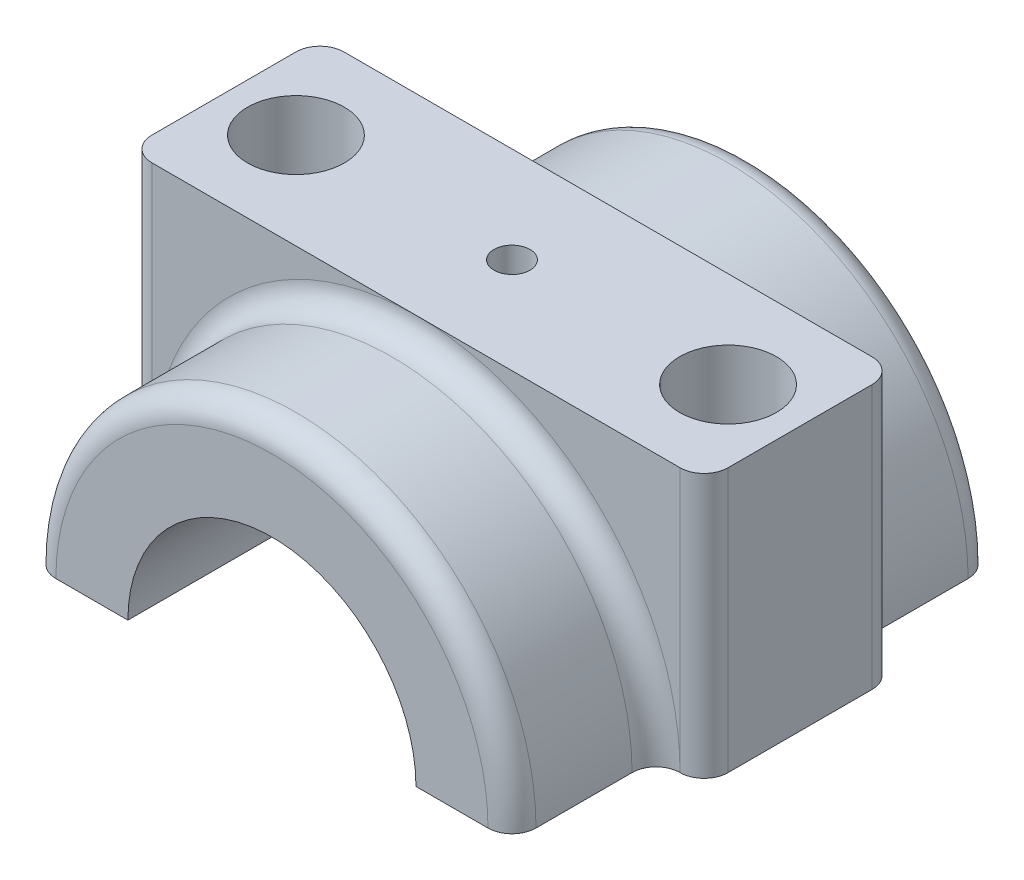
from build123d import *

# Parameters (mm, degrees)
SKETCH_2_W      = 72
SKETCH_2_H      = 24
SKETCH_2_R      = 6.05
SKETCH_2_R_2    = 2.25
EXTRUDE_1_DEPTH = 33
FILLET_1_R      = 3
EXTRUDE_2_DEPTH = 18
EXTRUDE_START   = 18
EXTRUDE_3_DEPTH = 18
FILLET_2_R      = 3


with BuildPart() as part:
    # 草圖2 → 填料-伸長1 (new body)
    with BuildSketch(Plane(origin=(0, 0, 0), x_dir=(1, 0, 0), z_dir=(0, 1, 0))):
        with Locations((36, 12)):
            Rectangle(SKETCH_2_W, SKETCH_2_H)
        with Locations(Location((9, 12, 0), (0, 0, 270))):
            Circle(SKETCH_2_R, mode=Mode.SUBTRACT)
        with Locations(Location((63, 12, 0), (0, 0, 270))):
            Circle(SKETCH_2_R, mode=Mode.SUBTRACT)
        with Locations(Location((36, 12, 0), (0, 0, 270))):
            Circle(SKETCH_2_R_2, mode=Mode.SUBTRACT)
    extrude(amount=EXTRUDE_1_DEPTH)

    # 圓角1
    fillet_1_edges = [part.edges().sort_by_distance(p)[0] for p in [
        (0, 16.5, -24),
        (72, 16.5, -24),
        (72, 16.5, 0),
        (0, 16.5, 0),
    ]]
    fillet(fillet_1_edges, radius=FILLET_1_R)

    # 草圖4 → 填料-伸長2 (add)
    with BuildSketch(Plane.XY):
        with BuildLine():
            ThreePointArc((66, 0), (36, 30), (6, 0))
            Line((6, 0), (18, 0))
            ThreePointArc((18, 0), (36, 18), (54, 0))
            Line((54, 0), (66, 0))
        make_face()
    extrude(amount=EXTRUDE_2_DEPTH)

    # 草圖5 → 填料-伸長3 (add)
    with BuildSketch(Plane(origin=(0, 0, -24), x_dir=(-1, 0, 0), z_dir=(0, 0, -1)).offset(EXTRUDE_START)):
        with BuildLine():
            ThreePointArc((-6, 0), (-36, 30), (-66, 0))
            Line((-66, 0), (-54, 0))
            ThreePointArc((-54, 0), (-36, 18), (-18, 0))
            Line((-18, 0), (-6, 0))
        make_face()
    extrude(amount=-EXTRUDE_3_DEPTH)

    # 圓角2
    fillet_2_edges = [part.edges().sort_by_distance(p)[0] for p in [
        (36, 30, -42),
        (36, 30, -24),
        (36, 30, 18),
        (36, 30, 0),
    ]]
    fillet(fillet_2_edges, radius=FILLET_2_R - 0.0001)  # a hair under: the kernel refuses the full size


solid = part.part
